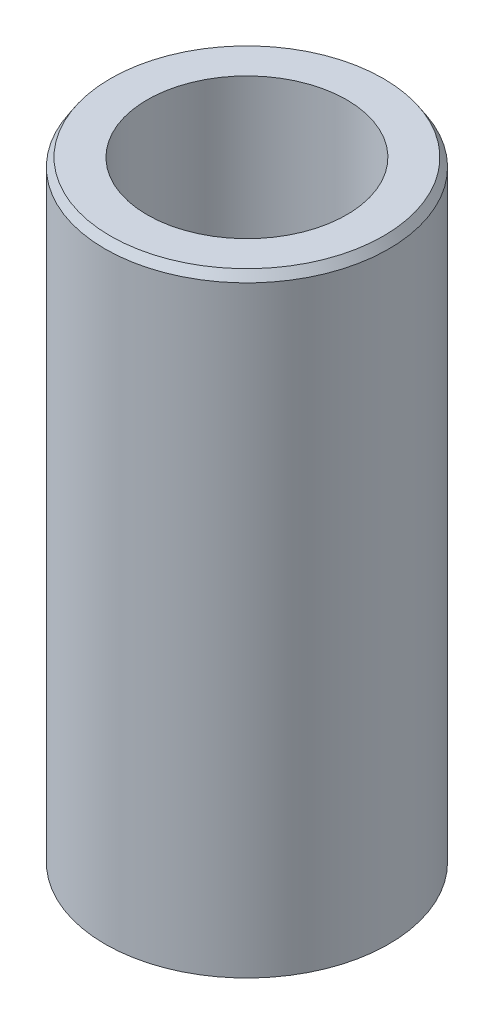
from build123d import *
from OCP.BRepFilletAPI import BRepFilletAPI_MakeChamfer

# Parameters (mm, degrees)
SKETCH1_R           = 40
BOSS_EXTRUDE1_DEPTH = 173.665812918
SKETCH2_R           = 28.116705364
CUT_EXTRUDE1_DEPTH  = 183.646693308
CHAMFER1_SIZE       = 2.391059831
CHAMFER1_SIZE2      = 1.525316293


with BuildPart() as part:
    # Sketch1 → Boss-Extrude1 (new body)
    with BuildSketch(Plane(origin=(0, 0, 0), x_dir=(1, 0, 0), z_dir=(0, 1, 0))):
        Circle(SKETCH1_R)
    extrude(amount=BOSS_EXTRUDE1_DEPTH)

    # Sketch2 → Cut-Extrude1 (cut, through all)
    with BuildSketch(Plane(origin=(0, 0, 0), x_dir=(1, 0, 0), z_dir=(0, 1, 0))):
        Circle(SKETCH2_R)
    extrude(amount=CUT_EXTRUDE1_DEPTH, mode=Mode.SUBTRACT)

    # Chamfer1: one chamfer whose edges measure the first distance from different faces: ONE call of the kernel's chamfer builder (chamfer() names one face for all edges)
    chamfer1_edges_1 = [part.edges().sort_by_distance(p)[0] for p in [
        (-40, 173.665812918, 0),
    ]]
    chamfer1_side_1 = [part.faces().sort_by_distance(p)[0] for p in [
        (-40, 86.832906459, 0),
    ]]
    chamfer1_edges_2 = [part.edges().sort_by_distance(p)[0] for p in [
        (-40, 0, 0),
    ]]
    chamfer1_side_2 = [part.faces().sort_by_distance(p)[0] for p in [
        (-38.86862915, 0, 0),
    ]]
    chamfer1 = BRepFilletAPI_MakeChamfer(part.part.solid().wrapped)
    for e in chamfer1_edges_1:
        chamfer1.Add(CHAMFER1_SIZE, CHAMFER1_SIZE2, e.wrapped, chamfer1_side_1[0].wrapped)  # the first distance lies on this face
    for e in chamfer1_edges_2:
        chamfer1.Add(CHAMFER1_SIZE, CHAMFER1_SIZE2, e.wrapped, chamfer1_side_2[0].wrapped)  # the first distance lies on this face
    add(Compound.cast(chamfer1.Shape()), mode=Mode.REPLACE)


solid = part.part
